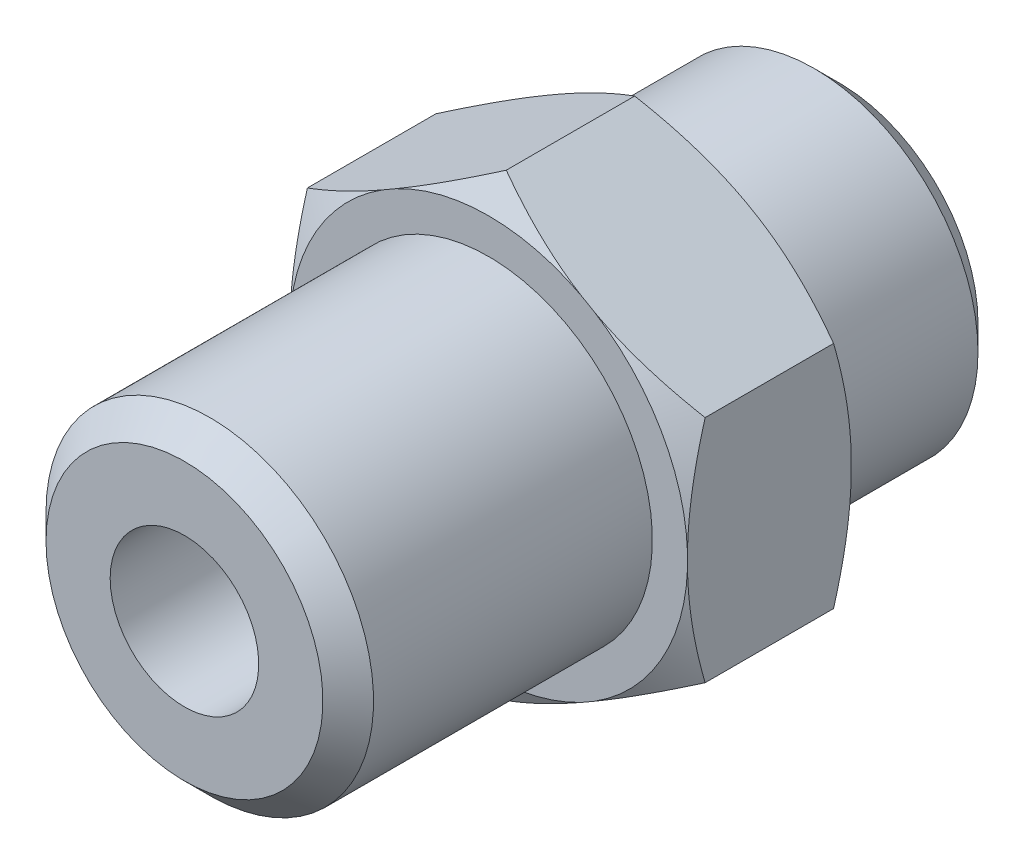
from build123d import *

# Parameters (mm, degrees)
SKETCH_1_R          = 7
EXTRUDE_1_DEPTH     = 28
EXTRUDE_START       = -8
EXTRUDE_2_DEPTH     = 7
SKETCH_6_R          = 5
CUT_EXTRUDE_1_DEPTH = 4
SKETCH_7_R          = 3.175
CUT_EXTRUDE_2_DEPTH = 28.287054318


# Read off the part's stored shape, not the designer's step: M14 机械螺纹 螺柱1, M14 机械螺纹 螺柱2
with BuildPart() as part:
    # 草图1 → 凸台-拉伸1 (new body)
    with BuildSketch(Plane.XY):
        Circle(SKETCH_1_R)
    extrude(amount=EXTRUDE_1_DEPTH)

    # M14 机械螺纹 螺柱1 outline → M14 机械螺纹 螺柱1 (revolve, cut)
    with BuildSketch(Plane.XZ):
        Polygon((7, 28), (5.9175, 28), (7, 26.9175), align=None)
    revolve(axis=Axis((0, 0, 0), (0, 0, 1)), mode=Mode.SUBTRACT)

    # M14 机械螺纹 螺柱2 outline → M14 机械螺纹 螺柱2 (revolve, cut)
    with BuildSketch(Plane.XZ):
        Polygon((7, 1.0825), (5.9175, 0), (7, 0), align=None)
    revolve(axis=Axis((0, 0, 0), (0, 0, 1)), mode=Mode.SUBTRACT)

    # 草图4 → 凸台-拉伸2 (add)
    with BuildSketch(Plane(origin=(0, 0, 0), x_dir=(-1, 0, 0), z_dir=(0, 0, -1)).offset(EXTRUDE_START)):
        Polygon((0, 9.814954576), (-8.5, 4.907477288), (-8.5, -4.907477288), (0, -9.814954576), (8.5, -4.907477288), (8.5, 4.907477288), align=None)
    extrude(amount=-EXTRUDE_2_DEPTH)

    # 草图5 → 切除-旋转1 (revolve, cut)
    with BuildSketch(Plane(origin=(0, 0, 0), x_dir=(0, 0, -1), z_dir=(1, 0, 0)), mode=Mode.PRIVATE) as cut_revolve_1_sk:
        Polygon((-8, 8.50620211), (-8.755608589, 9.814954576), (-8, 9.814954576), align=None)
        Polygon((-15, 8.50620211), (-14.244391411, 9.814954576), (-15, 9.814954576), align=None)
    revolve(cut_revolve_1_sk.sketch.rotate(Axis((0, 0, 0), (0, 0, -1)), 270), axis=Axis((0, 0, 0), (0, 0, -1)), mode=Mode.SUBTRACT)

    # 草图6 → 切除-拉伸1 (cut)
    with BuildSketch(Plane(origin=(0, 0, 0), x_dir=(-1, 0, 0), z_dir=(0, 0, -1))):
        Circle(SKETCH_6_R)
    extrude(amount=-CUT_EXTRUDE_1_DEPTH, mode=Mode.SUBTRACT)

    # 草图7 → 切除-拉伸2 (cut, through all)
    with BuildSketch(Plane(origin=(0, 0, 4), x_dir=(-1, 0, 0), z_dir=(0, 0, -1))):
        Circle(SKETCH_7_R)
    extrude(amount=-CUT_EXTRUDE_2_DEPTH, mode=Mode.SUBTRACT)


solid = part.part
